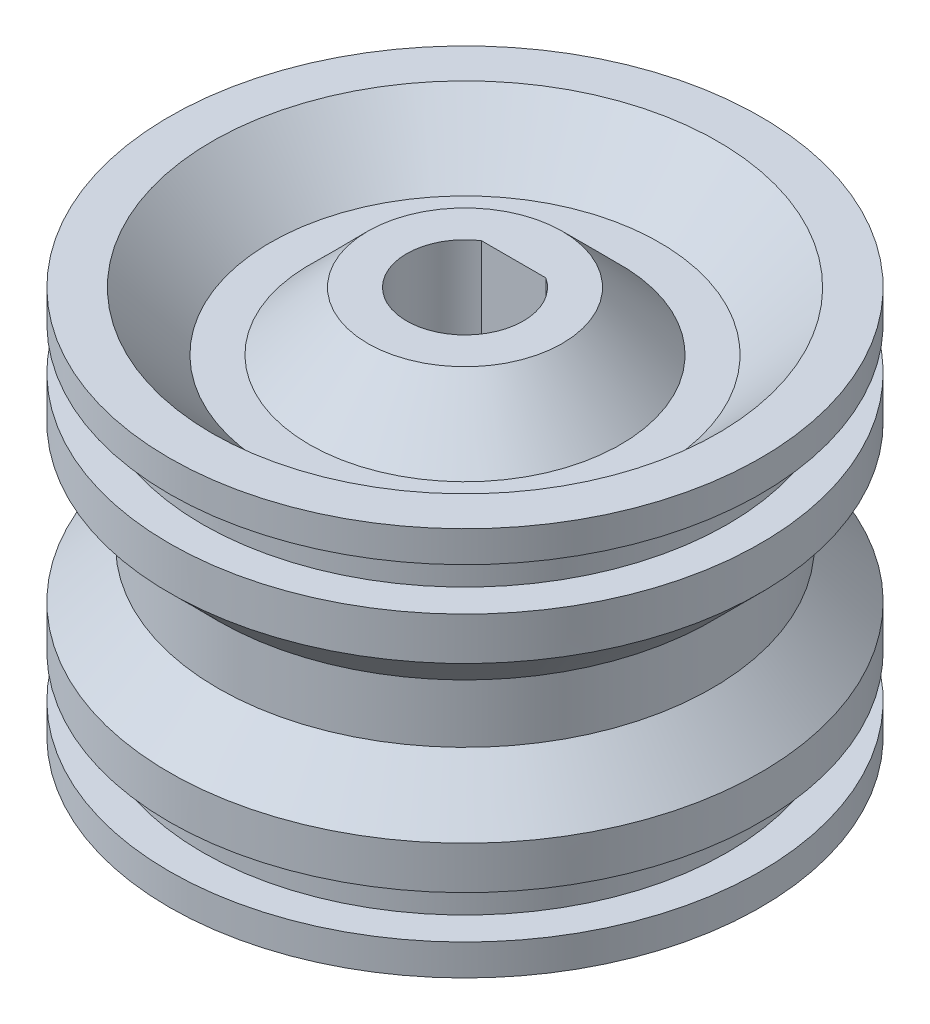
from build123d import *

# Parameters (mm, degrees)
SKETCH_1_R          = 15.2
EXTRUDE_1_DEPTH     = 10
SKETCH_2_W          = 1.7
SKETCH_2_H          = 2.2
SKETCH_4_R          = 10
CUT_EXTRUDE_1_DEPTH = 12
CUT_EXTRUDE_2_DEPTH = 15
CHAMFER_1_SIZE      = 3
CUT_EXTRUDE_START   = -3
SKETCH_6_R          = 10
SKETCH_6_R_2        = 5
CUT_EXTRUDE_3_DEPTH = 3
CHAMFER_2_SIZE      = 3
SKETCH_7_W          = 2.5
SKETCH_7_H          = 8
CHAMFER_3_SIZE      = 2.5
CHAMFER_4_SIZE      = 2


with BuildPart() as part:
    # 草图1 → 凸台-拉伸1 (new, symmetric)
    with BuildSketch(Plane(origin=(0, 0, 0), x_dir=(1, 0, 0), z_dir=(0, 1, 0))):
        with Locations(Location((0, 0, 0), (0, 0, 270))):
            Circle(SKETCH_1_R)
    extrude(amount=EXTRUDE_1_DEPTH, both=True)

    # 草图2 → 切除-旋转1 (revolve, cut)
    with BuildSketch(Plane.XY, mode=Mode.PRIVATE) as cut_revolve_1_sk:
        with Locations((14.35, 7.3)):
            Rectangle(SKETCH_2_W, SKETCH_2_H)
    cut_revolve_1 = revolve(cut_revolve_1_sk.sketch.rotate(Axis((0, 8.4, 0), (0, -1, 0)), 90), axis=Axis((0, 8.4, 0), (0, -1, 0)), mode=Mode.SUBTRACT)

    # 镜向1: 切除-旋转1 across plane
    add(cut_revolve_1.mirror(Plane.ZX), mode=Mode.SUBTRACT)

    # 草图4 → 切除-拉伸1 (cut)
    with BuildSketch(Plane.XZ.offset(10)):
        with Locations(Location((0, 0, 0), (0, 0, 270))):
            Circle(SKETCH_4_R)
    extrude(amount=-CUT_EXTRUDE_1_DEPTH, mode=Mode.SUBTRACT)

    # 草图5 → 切除-拉伸2 (cut)
    with BuildSketch(Plane(origin=(0, 10, 0), x_dir=(1, 0, 0), z_dir=(0, 1, 0))):
        with BuildLine():
            Line((1.658312395, 2.5), (-1.658312395, 2.5))
            ThreePointArc((-1.658312395, 2.5), (-1.418637165, -2.643382037), (3, 0))
            ThreePointArc((3, 0), (2.643382037, 1.418637165), (1.658312395, 2.5))
        make_face()
    extrude(amount=-CUT_EXTRUDE_2_DEPTH, mode=Mode.SUBTRACT)

    # 倒角1
    chamfer_1_edges = [part.edges().sort_by_distance(p)[0] for p in [
        (0, -10, 10),
    ]]
    chamfer(chamfer_1_edges, length=CHAMFER_1_SIZE)

    # 草图6 → 切除-拉伸3 (cut)
    with BuildSketch(Plane(origin=(0, 10, 0), x_dir=(1, 0, 0), z_dir=(0, 1, 0)).offset(CUT_EXTRUDE_START)):
        with Locations(Location((0, 0, 0), (0, 0, 90))):
            Circle(SKETCH_6_R)
        with Locations(Location((0, 0, 0), (0, 0, 270))):
            Circle(SKETCH_6_R_2, mode=Mode.SUBTRACT)
    extrude(amount=CUT_EXTRUDE_3_DEPTH, mode=Mode.SUBTRACT)

    # 倒角2
    chamfer_2_edges = [part.edges().sort_by_distance(p)[0] for p in [
        (0, 7, -5),
        (0, 10, 10),
    ]]
    chamfer(chamfer_2_edges, length=CHAMFER_2_SIZE - 0.0001)  # a hair under: the kernel refuses the full size

    # 草图7 → 切除-旋转2 (revolve, cut)
    with BuildSketch(Plane(origin=(0, 0, 0), x_dir=(0, 0, -1), z_dir=(1, 0, 0))):
        with Locations((13.95, 0)):
            Rectangle(SKETCH_7_W, SKETCH_7_H)
    revolve(axis=Axis((0, 2, 0), (0, 1, 0)), mode=Mode.SUBTRACT)

    # 倒角3
    chamfer_3_edges = [part.edges().sort_by_distance(p)[0] for p in [
        (0, -4, 12.7),
        (0, 4, 12.7),
    ]]
    chamfer(chamfer_3_edges, length=CHAMFER_3_SIZE - 0.0001)  # a hair under: the kernel refuses the full size

    # 倒角4
    chamfer_4_edges = [part.edges().sort_by_distance(p)[0] for p in [
        (0, 2, 10),
    ]]
    chamfer(chamfer_4_edges, length=CHAMFER_4_SIZE)


solid = part.part
